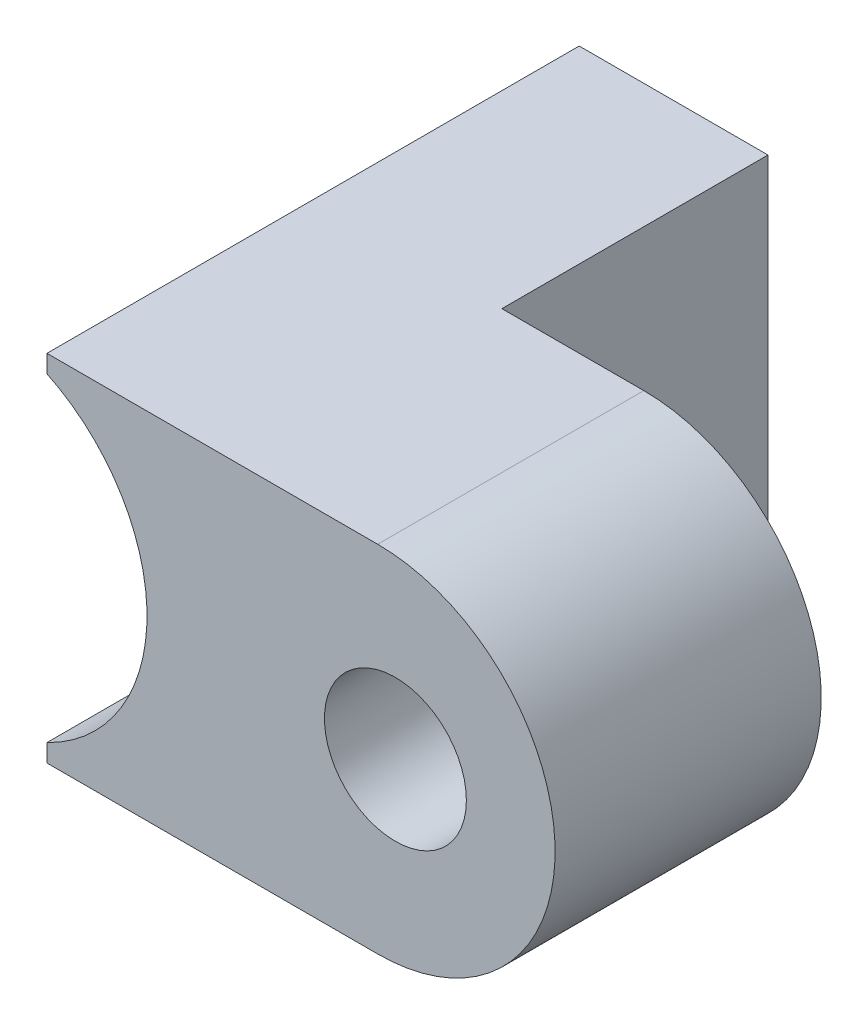
from build123d import *

# Parameters (mm, degrees)
BOSS_EXTRUDE1_DEPTH          = 38.1
CUT_EXTRUDE1_DEPTH           = 19.05
F_3_8_0_375_DIAMETER_HOLE1_D = 10.16
CHAMFER1_SIZE                = 1.27


with BuildPart() as part:
    # Sketch1 → Boss-Extrude1 (new body)
    with BuildSketch(Plane.XY):
        with BuildLine():
            Line((5.535801658, 0), (29.21, 0))
            ThreePointArc((29.21, 0), (41.91, 12.7), (29.21, 25.4))
            Line((29.21, 25.4), (5.535801658, 25.4))
            Line((5.535801658, 25.4), (5.535801658, 24.13))
            ThreePointArc((5.535801658, 24.13), (12.7, 12.7), (5.535801658, 1.27))
            Line((5.535801658, 1.27), (5.535801658, 0))
        make_face()
    extrude(amount=BOSS_EXTRUDE1_DEPTH)

    # Sketch2 → Cut-Extrude1 (cut)
    with BuildSketch(Plane(origin=(0, 0, 0), x_dir=(-1, 0, 0), z_dir=(0, 0, -1))):
        with BuildLine():
            Line((-19.05, 0), (-19.05, 25.4))
            Line((-19.05, 25.4), (-29.21, 25.4))
            ThreePointArc((-29.21, 25.4), (-41.91, 12.7), (-29.21, 0))
            Line((-29.21, 0), (-19.05, 0))
        make_face()
    extrude(amount=-CUT_EXTRUDE1_DEPTH, mode=Mode.SUBTRACT)

    # 3/8 (0.375) Diameter Hole1 (through all)
    with Locations(Plane.XY.offset(38.1)):
        with Locations((30.48, 12.7)):
            Hole(F_3_8_0_375_DIAMETER_HOLE1_D / 2)

    # Chamfer1
    chamfer1_edges = [part.edges().sort_by_distance(p)[0] for p in [
        (19.05, 0, 9.525),
    ]]
    chamfer(chamfer1_edges, length=CHAMFER1_SIZE)


solid = part.part
